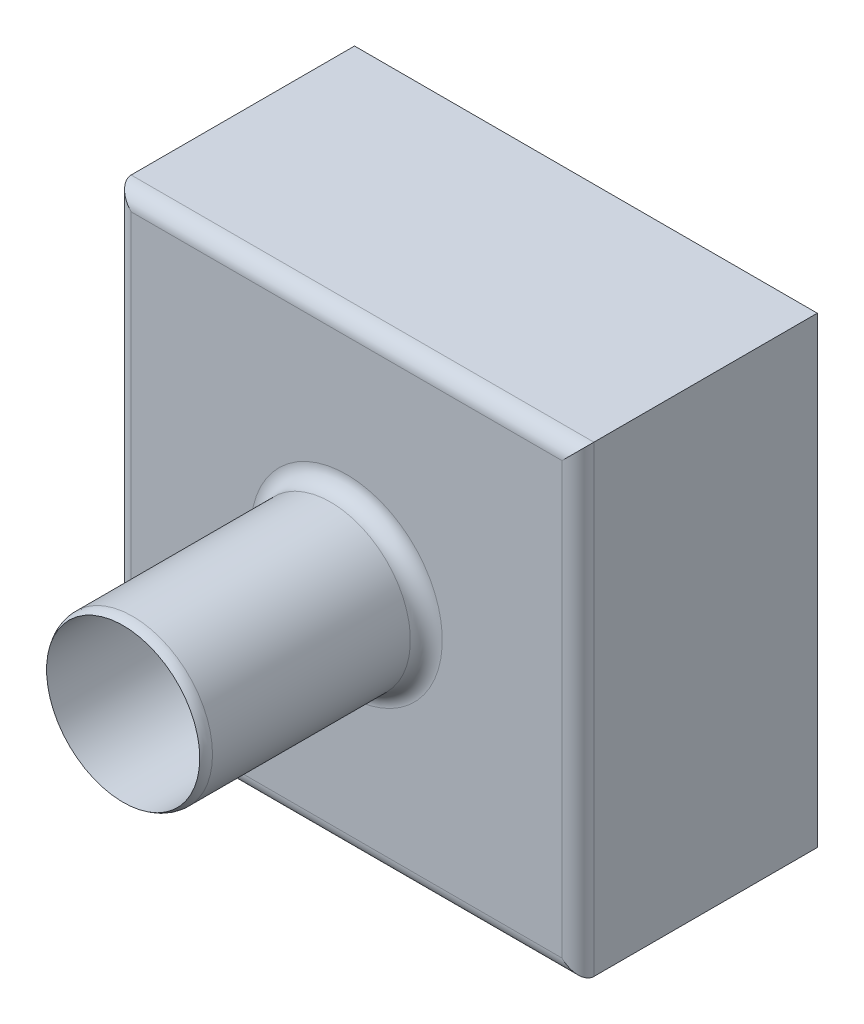
from build123d import *

# Parameters (mm, degrees)
SKETCH1_W           = 29
SKETCH1_H           = 29
BOSS_EXTRUDE1_DEPTH = 15
SKETCH2_R           = 5
CUT_EXTRUDE1_DEPTH  = 44.669211122
SKETCH3_W           = 22.2
SKETCH3_H           = 22.2
CUT_EXTRUDE2_DEPTH  = 13
FILLET2_R           = 1
FILLET3_R           = 1
BOSS_EXTRUDE3_START = 15
SKETCH7_R           = 5
BOSS_EXTRUDE3_DEPTH = 15
SKETCH8_R           = 4.8
CUT_EXTRUDE4_DEPTH  = 15
FILLET4_R           = 1


with BuildPart() as part:
    # Sketch1 → Boss-Extrude1 (new body)
    with BuildSketch(Plane.XY):
        with Locations((-14.5, -14.5)):
            Rectangle(SKETCH1_W, SKETCH1_H)
    extrude(amount=BOSS_EXTRUDE1_DEPTH)

    # Sketch2 → Cut-Extrude1 (cut, through all)
    with BuildSketch(Plane.XY.offset(15)):
        with Locations((-14.5, -14.5)):
            Circle(SKETCH2_R)
    extrude(amount=-CUT_EXTRUDE1_DEPTH, mode=Mode.SUBTRACT)

    # Sketch3 → Cut-Extrude2 (cut)
    with BuildSketch(Plane(origin=(0, 0, 0), x_dir=(-1, 0, 0), z_dir=(0, 0, -1))):
        with Locations((12.6, -16.4)):
            Rectangle(SKETCH3_W, SKETCH3_H)
    extrude(amount=-CUT_EXTRUDE2_DEPTH, mode=Mode.SUBTRACT)

    # Fillet2
    fillet2_edges = [part.edges().sort_by_distance(p)[0] for p in [
        (-1.5, -16.4, 13),
        (-12.6, -5.3, 13),
        (-23.7, -16.4, 13),
        (-12.6, -27.5, 13),
        (-19.5, -14.5, 13),
    ]]
    fillet(fillet2_edges, radius=FILLET2_R)

    # Fillet3
    # the kernel refuses this fillet: 1 mm, written as the material it adds along each edge
    with BuildSketch(Plane(origin=(-22.7, -26.5, 12), x_dir=(0, -1, 0), z_dir=(-1, 0, 0))) as fillet3_piece_1_section:
        Polygon((0, 0), (FILLET3_R, 0), (FILLET3_R, FILLET3_R), (0, FILLET3_R), align=None)
    fillet3_piece_1 = extrude(amount=FILLET3_R, mode=Mode.PRIVATE)
    fillet3_piece_1 = fillet3_piece_1 - Plane(origin=(-22.7, -26.5, 12), x_dir=(0, 0.7071067811865475, -0.7071067811865475), z_dir=(-1, 0, 0)) * Sphere(FILLET3_R, mode=Mode.PRIVATE)
    add(fillet3_piece_1)
    with BuildSketch(Plane(origin=(-2.5, -26.5, 12), x_dir=(0, -1, 0), z_dir=(1, 0, 0))) as fillet3_piece_2_section:
        Polygon((0, 0), (FILLET3_R, 0), (FILLET3_R, -FILLET3_R), (0, -FILLET3_R), align=None)
    fillet3_piece_2 = extrude(amount=FILLET3_R, mode=Mode.PRIVATE)
    fillet3_piece_2 = fillet3_piece_2 - Plane(origin=(-2.5, -26.5, 12), x_dir=(0, 0.7071067811865475, -0.7071067811865475), z_dir=(1, 0, 0)) * Sphere(FILLET3_R, mode=Mode.PRIVATE)
    add(fillet3_piece_2)
    with BuildSketch(Plane(origin=(-22.7, -6.3, 12), x_dir=(-1, 0, 0), z_dir=(0, 1, 0))) as fillet3_piece_3_section:
        Polygon((0, 0), (FILLET3_R, 0), (FILLET3_R, FILLET3_R), (0, FILLET3_R), align=None)
    fillet3_piece_3 = extrude(amount=FILLET3_R, mode=Mode.PRIVATE)
    fillet3_piece_3 = fillet3_piece_3 - Plane(origin=(-22.7, -6.3, 12), x_dir=(0.7071067811865475, 0, -0.7071067811865475), z_dir=(0, 1, 0)) * Sphere(FILLET3_R, mode=Mode.PRIVATE)
    add(fillet3_piece_3)
    with BuildSketch(Plane(origin=(-2.5, -6.3, 12), x_dir=(1, 0, 0), z_dir=(0, 1, 0))) as fillet3_piece_4_section:
        Polygon((0, 0), (FILLET3_R, 0), (FILLET3_R, -FILLET3_R), (0, -FILLET3_R), align=None)
    fillet3_piece_4 = extrude(amount=FILLET3_R, mode=Mode.PRIVATE)
    fillet3_piece_4 = fillet3_piece_4 - Plane(origin=(-2.5, -6.3, 12), x_dir=(-0.7071067811865475, 0, -0.7071067811865475), z_dir=(0, 1, 0)) * Sphere(FILLET3_R, mode=Mode.PRIVATE)
    add(fillet3_piece_4)
    with BuildSketch(Plane(origin=(-1.5, -5.3, 0), x_dir=(-1, 0, 0), z_dir=(0, 0, 1)), Plane(origin=(-1.5, -27.5, 0), x_dir=(0, 1, 0), z_dir=(0, 0, 1))) as fillet3_piece_5:
        with BuildLine():
            CenterArc((FILLET3_R, FILLET3_R), FILLET3_R, 180, 90)
            Line((0, FILLET3_R), (0, 0))
            Line((0, 0), (FILLET3_R, 0))
        make_face()
    extrude(amount=12)
    with BuildSketch(Plane(origin=(-23.7, -5.3, 0), x_dir=(1, 0, 0), z_dir=(0, 0, 1)), Plane(origin=(-23.7, -27.5, 0), x_dir=(0, 1, 0), z_dir=(0, 0, 1))) as fillet3_piece_6:
        with BuildLine():
            CenterArc((FILLET3_R, -FILLET3_R), FILLET3_R, 90, 90)
            Line((0, -FILLET3_R), (0, 0))
            Line((0, 0), (FILLET3_R, 0))
        make_face()
    extrude(amount=12)
    # the kernel refuses this fillet: 1 mm, written as the material it takes off along each edge
    with BuildSketch(Plane(origin=(-1.5, -26.5, 0), x_dir=(1, 0, 0), z_dir=(0, 1, 0)), Plane(origin=(-22.7, -27.5, 0), x_dir=(0, -1, 0), z_dir=(1, 0, 0)), Plane(origin=(-23.7, -6.3, 0), x_dir=(-1, 0, 0), z_dir=(0, -1, 0)), Plane(origin=(-2.5, -5.3, 0), x_dir=(0, 1, 0), z_dir=(-1, 0, 0))) as fillet3_2_piece_1:
        with BuildLine():
            CenterArc((FILLET3_R, -FILLET3_R), FILLET3_R, 90, 90)
            Line((0, -FILLET3_R), (0, 0))
            Line((0, 0), (FILLET3_R, 0))
        make_face()
    extrude(amount=20.2, mode=Mode.SUBTRACT)
    with BuildSketch(Plane(origin=(-2.5, -6.3, 0), x_dir=(0, 1, 0), z_dir=(-1, 0, 0))) as fillet3_2_piece_2:
        with BuildLine():
            CenterArc((1 + FILLET3_R, -FILLET3_R), FILLET3_R, 90, 90)
            Line((1, -FILLET3_R), (1, 0))
            Line((1, 0), (1 + FILLET3_R, 0))
        make_face()
    revolve(axis=Axis((-2.5, -6.3, 0), (0, 0, -1)), revolution_arc=90, mode=Mode.SUBTRACT)
    with BuildSketch(Plane(origin=(-22.7, -6.3, 0), x_dir=(0, 1, 0), z_dir=(1, 0, 0))) as fillet3_2_piece_3:
        with BuildLine():
            CenterArc((1 + FILLET3_R, FILLET3_R), FILLET3_R, 180, 90)
            Line((1, FILLET3_R), (1, 0))
            Line((1, 0), (1 + FILLET3_R, 0))
        make_face()
    revolve(axis=Axis((-22.7, -6.3, 0), (0, 0, 1)), revolution_arc=90, mode=Mode.SUBTRACT)
    with BuildSketch(Plane(origin=(-22.7, -26.5, 0), x_dir=(-1, 0, 0), z_dir=(0, 1, 0))) as fillet3_2_piece_4:
        with BuildLine():
            CenterArc((1 + FILLET3_R, FILLET3_R), FILLET3_R, 180, 90)
            Line((1, FILLET3_R), (1, 0))
            Line((1, 0), (1 + FILLET3_R, 0))
        make_face()
    revolve(axis=Axis((-22.7, -26.5, 0), (0, 0, 1)), revolution_arc=90, mode=Mode.SUBTRACT)
    with BuildSketch(Plane(origin=(-2.5, -26.5, 0), x_dir=(1, 0, 0), z_dir=(0, 1, 0))) as fillet3_2_piece_5:
        with BuildLine():
            CenterArc((1 + FILLET3_R, -FILLET3_R), FILLET3_R, 90, 90)
            Line((1, -FILLET3_R), (1, 0))
            Line((1, 0), (1 + FILLET3_R, 0))
        make_face()
    revolve(axis=Axis((-2.5, -26.5, 0), (0, 0, -1)), revolution_arc=90, mode=Mode.SUBTRACT)

    # Sketch7 → Boss-Extrude3 (add)
    with BuildSketch(Plane.XY.offset(14).offset(BOSS_EXTRUDE3_START)):
        with Locations((-14.5, -14.5)):
            Circle(SKETCH7_R)
    extrude(amount=-BOSS_EXTRUDE3_DEPTH)

    # Sketch8 → Cut-Extrude4 (cut)
    with BuildSketch(Plane.XY.offset(29)):
        with Locations((-14.5, -14.5)):
            Circle(SKETCH8_R)
    extrude(amount=-CUT_EXTRUDE4_DEPTH, mode=Mode.SUBTRACT)

    # Fillet4
    # the kernel refuses this fillet: 1 mm, written as the material it adds along each edge
    with BuildSketch(Plane(origin=(-14.5, -14.5, 15), x_dir=(1, 0, 0), z_dir=(0, -1, 0))) as fillet4_piece_1:
        with BuildLine():
            CenterArc((5 + FILLET4_R, FILLET4_R), FILLET4_R, 180, 90)
            Line((5, FILLET4_R), (5, 0))
            Line((5, 0), (5 + FILLET4_R, 0))
        make_face()
    revolve(axis=Axis((-14.5, -14.5, 15), (0, 0, 1)))
    # the kernel refuses this fillet: 1 mm, written as the material it takes off along each edge
    with BuildSketch(Plane(origin=(-29, 2.5, 15), x_dir=(0, 0, -1), z_dir=(0, -1, 0)), Plane(origin=(-31.5, -29, 15), x_dir=(0, 0, -1), z_dir=(1, 0, 0)), Plane(origin=(0, -31.5, 15), x_dir=(0, 0, -1), z_dir=(0, 1, 0)), Plane(origin=(2.5, 0, 15), x_dir=(0, 0, -1), z_dir=(-1, 0, 0))) as fillet4_2_piece_1:
        with BuildLine():
            CenterArc((FILLET4_R, FILLET4_R), FILLET4_R, 180, 90)
            Line((0, FILLET4_R), (0, 0))
            Line((0, 0), (FILLET4_R, 0))
        make_face()
    extrude(amount=34, mode=Mode.SUBTRACT)
    with BuildSketch(Plane(origin=(-14.5, -14.5, 29), x_dir=(1, 0, 0), z_dir=(0, -1, 0))) as fillet4_2_piece_2:
        with BuildLine():
            CenterArc((4, -0.6), FILLET4_R, 0, 36.869897646)
            Line((4.8, 0), (5, 0))
            Line((5, 0), (5, -0.6))
        make_face()
    revolve(axis=Axis((-14.5, -14.5, 29), (0, 0, 1)), mode=Mode.SUBTRACT)


solid = part.part
